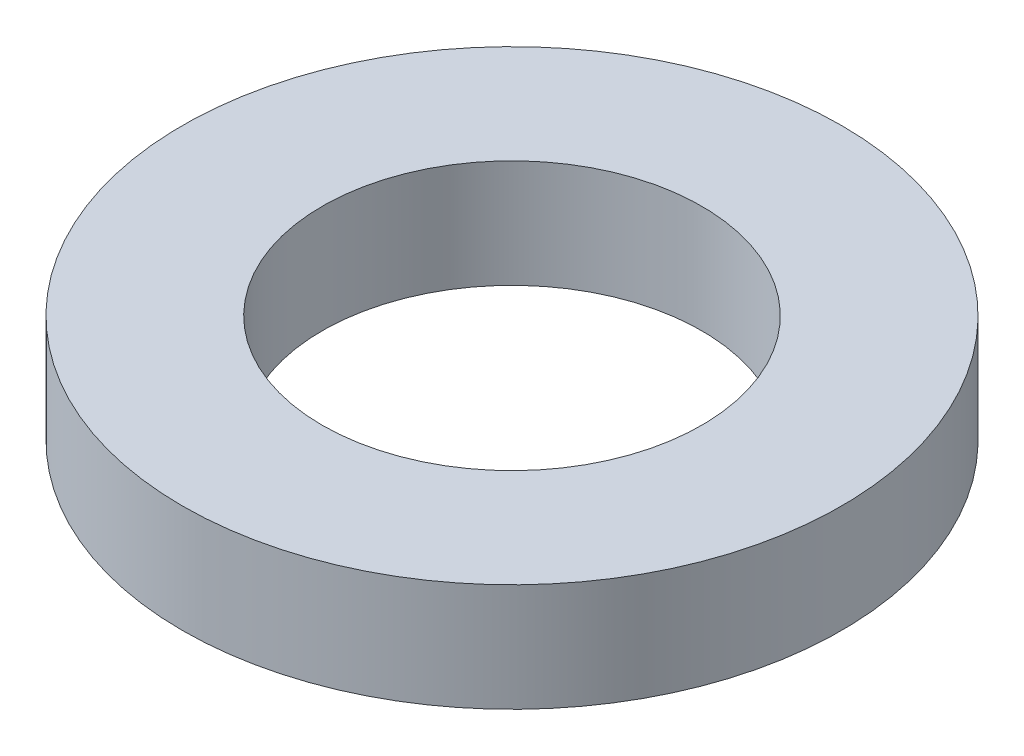
from build123d import *

# Parameters (mm, degrees)
SKETCH1_R           = 82.5
BOSS_EXTRUDE1_DEPTH = 27
SKETCH2_R           = 47.5
CUT_EXTRUDE1_DEPTH  = 120.756001937


with BuildPart() as part:
    # Sketch1 → Boss-Extrude1 (new body)
    with BuildSketch(Plane(origin=(0, 0, 0), x_dir=(1, 0, 0), z_dir=(0, 1, 0))):
        Circle(SKETCH1_R)
    extrude(amount=BOSS_EXTRUDE1_DEPTH)

    # Sketch2 → Cut-Extrude1 (cut, through all)
    with BuildSketch(Plane(origin=(0, 0, 0), x_dir=(1, 0, 0), z_dir=(0, 1, 0))):
        Circle(SKETCH2_R)
    extrude(amount=CUT_EXTRUDE1_DEPTH, mode=Mode.SUBTRACT)


solid = part.part
